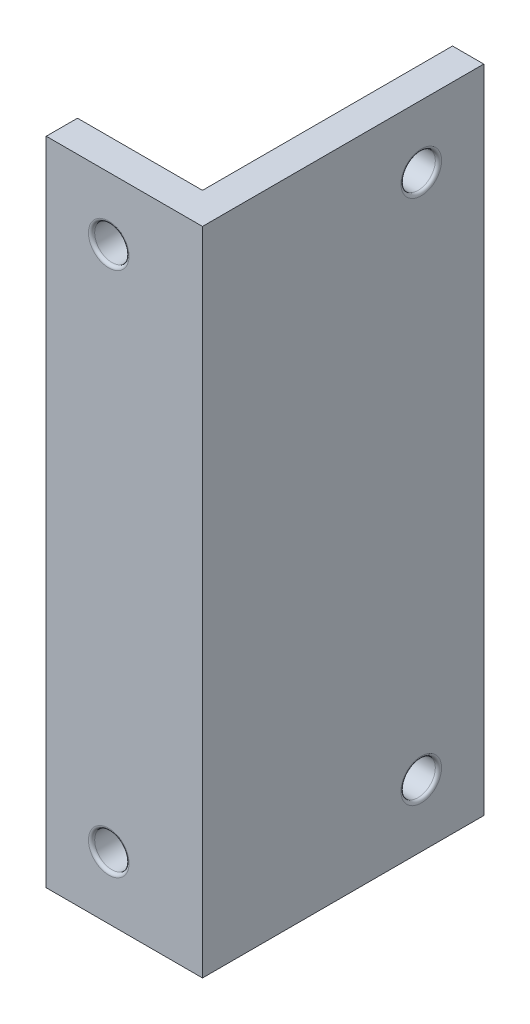
from build123d import *

# Parameters (mm, degrees)
BOSS_EXTRUDE1_DEPTH = 104.14
SKETCH2_R           = 2.75
CUT_EXTRUDE1_DEPTH  = 115.133209891
SKETCH3_R           = 2.75
CUT_EXTRUDE2_DEPTH  = 116.223216411
FILLET1_R           = 0.5


with BuildPart() as part:
    # Sketch1 → Boss-Extrude1 (new body)
    with BuildSketch(Plane(origin=(0, 0, 0), x_dir=(1, 0, 0), z_dir=(0, 1, 0))):
        Polygon((-12.5, -2.5), (12.5, -2.5), (12.5, 2.5), (12.5, 42.5), (7.5, 42.5), (7.5, 2.5), (-12.5, 2.5), align=None)
    extrude(amount=BOSS_EXTRUDE1_DEPTH)

    # Sketch2 → Cut-Extrude1 (cut, through all)
    with BuildSketch(Plane.XY.offset(2.5)):
        with Locations((-2.5, 94.14)):
            Circle(SKETCH2_R)
        with Locations((-2.5, 10)):
            Circle(SKETCH2_R)
    extrude(amount=-CUT_EXTRUDE1_DEPTH, mode=Mode.SUBTRACT)

    # Sketch3 → Cut-Extrude2 (cut, through all)
    with BuildSketch(Plane(origin=(12.5, 0, 0), x_dir=(0, 0, -1), z_dir=(1, 0, 0))):
        with Locations((32.5, 94.14)):
            Circle(SKETCH3_R)
        with Locations((32.5, 10)):
            Circle(SKETCH3_R)
    extrude(amount=-CUT_EXTRUDE2_DEPTH, mode=Mode.SUBTRACT)

    # Fillet1
    fillet1_edges = [part.edges().sort_by_distance(p)[0] for p in [
        (7.5, 94.14, -29.75),
        (12.5, 94.14, -29.75),
        (7.5, 10, -29.75),
        (12.5, 10, -29.75),
        (-5.25, 10, -2.5),
        (-5.25, 10, 2.5),
        (-5.25, 94.14, -2.5),
        (-5.25, 94.14, 2.5),
    ]]
    fillet(fillet1_edges, radius=FILLET1_R)


solid = part.part
